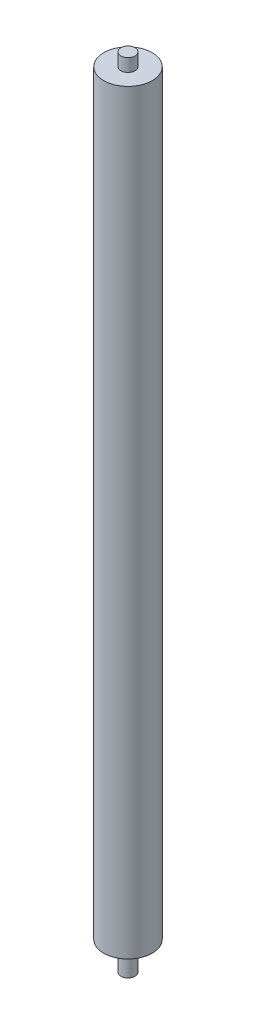
from build123d import *

# Parameters (mm, degrees)
SKETCH1_R           = 10
BOSS_EXTRUDE1_DEPTH = 40
SKETCH2_R           = 34
BOSS_EXTRUDE2_DEPTH = 1060
SKETCH3_R           = 10
BOSS_EXTRUDE3_DEPTH = 18


with BuildPart() as part:
    # Sketch1 → Boss-Extrude1 (new body)
    with BuildSketch(Plane(origin=(0, 0, 0), x_dir=(1, 0, 0), z_dir=(0, 1, 0))):
        Circle(SKETCH1_R)
    extrude(amount=BOSS_EXTRUDE1_DEPTH)

    # Sketch2 → Boss-Extrude2 (add)
    with BuildSketch(Plane(origin=(0, 40, 0), x_dir=(1, 0, 0), z_dir=(0, 1, 0))):
        Circle(SKETCH2_R)
    extrude(amount=BOSS_EXTRUDE2_DEPTH)

    # Sketch3 → Boss-Extrude3 (add)
    with BuildSketch(Plane(origin=(0, 1100, 0), x_dir=(1, 0, 0), z_dir=(0, 1, 0))):
        Circle(SKETCH3_R)
    extrude(amount=BOSS_EXTRUDE3_DEPTH)


solid = part.part
